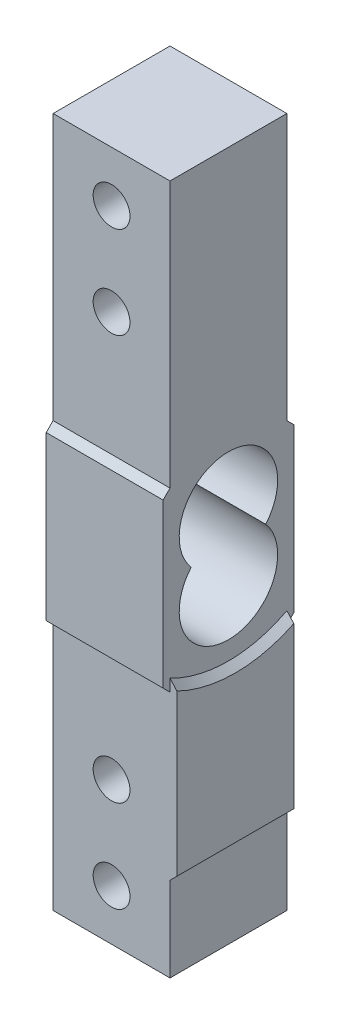
from build123d import *

# Parameters (mm, degrees)
SKETCH1_W               = 12.7
SKETCH1_H               = 12.7
BOSS_EXTRUDE1_DEPTH     = 37.5
CUT_EXTRUDE1_DEPTH      = 39.560277489
CUT_EXTRUDE1_DEPTH_BACK = 39.560277489
BOSS_EXTRUDE2_START     = -6.35
SKETCH3_W               = 0.75
SKETCH3_H               = 21.7
BOSS_EXTRUDE2_DEPTH     = 12.7
BOSS_EXTRUDE3_DEPTH     = 0.75
CHAMFER1_SIZE           = 2
CUT_EXTRUDE2_DEPTH      = 39.820999472
CUT_EXTRUDE2_DEPTH_BACK = 39.820999472
SKETCH5_R               = 2


with BuildPart() as part:
    # Sketch1 → Boss-Extrude1 (new, symmetric)
    with BuildSketch(Plane(origin=(0, 0, 0), x_dir=(1, 0, 0), z_dir=(0, 1, 0))):
        Rectangle(SKETCH1_W, SKETCH1_H)
    extrude(amount=BOSS_EXTRUDE1_DEPTH, both=True)

    # Sketch2 → Cut-Extrude1 (cut, two sides: drawn at the far end of the back side and taken through both)
    with BuildSketch(Plane(origin=(0, 0, 0), x_dir=(0, 0, -1), z_dir=(1, 0, 0)).offset(-CUT_EXTRUDE1_DEPTH_BACK)):
        with BuildLine():
            ThreePointArc((4.046294601, 0), (0, 8.85), (-4.046294601, 0))
            ThreePointArc((-4.046294601, 0), (0, -8.85), (4.046294601, 0))
        make_face()
    extrude(amount=CUT_EXTRUDE1_DEPTH + CUT_EXTRUDE1_DEPTH_BACK, mode=Mode.SUBTRACT)

    # Sketch3 → Boss-Extrude2 (add)
    with BuildSketch(Plane(origin=(0, 0, 0), x_dir=(0, 0, -1), z_dir=(1, 0, 0)).offset(BOSS_EXTRUDE2_START)):
        with Locations((6.725, -1)):
            Rectangle(SKETCH3_W, SKETCH3_H)
        with Locations((-6.725, -1)):
            Rectangle(SKETCH3_W, SKETCH3_H)
    extrude(amount=BOSS_EXTRUDE2_DEPTH)

    # Sketch4 → Boss-Extrude3 (add)
    with BuildSketch(Plane(origin=(6.35, 0, 0), x_dir=(0, 0, -1), z_dir=(1, 0, 0))):
        with BuildLine():
            Line((-6.35, -7.85), (-6.35, -29.55))
            Line((-6.35, -29.55), (6.35, -29.55))
            Line((6.35, -29.55), (6.35, -7.85))
            ThreePointArc((6.35, -7.85), (0, -9.6), (-6.35, -7.85))
        make_face()
    extrude(amount=BOSS_EXTRUDE3_DEPTH)

    # Chamfer1
    # the kernel refuses this chamfer: 2 mm, written as the material it takes off along each edge
    with BuildSketch(Plane(origin=(7.1, -29.55, 11.493365976), x_dir=(-0.9996219169112968, -0.027495876610585623, 0), z_dir=(0, 0, -1))) as chamfer1_piece_1_section:
        Polygon((CHAMFER1_SIZE * 0.999621916911, CHAMFER1_SIZE * 0.0274958766106), (-CHAMFER1_SIZE * 0.0274958766106, CHAMFER1_SIZE * 0.999621916911), (0, 0), align=None)
    chamfer1_piece_1 = extrude(amount=22.986731952, mode=Mode.PRIVATE)
    chamfer1_piece_1 = split(chamfer1_piece_1, bisect_by=Plane(origin=(6.35, -28.711332072, 0), z_dir=(1, 0, 0)), keep=Keep.TOP, mode=Mode.PRIVATE)
    add(chamfer1_piece_1, mode=Mode.SUBTRACT)
    with BuildSketch(Plane(origin=(7.1, 2.795714286, 0), x_dir=(0, -0.5793710900712427, -0.8150638870601863), z_dir=(0, 0.8150638870601863, -0.5793710900712427))) as chamfer1_piece_2_section:
        Polygon((12.395714286, CHAMFER1_SIZE), (12.395714286 + CHAMFER1_SIZE, 0), (12.395714286, 0), align=None)
    chamfer1_piece_2 = revolve(axis=Axis((7.1, 2.795714286, 0), (-1, 0, 0)), revolution_arc=109.187358772, mode=Mode.PRIVATE)
    chamfer1_piece_2 = split(chamfer1_piece_2, bisect_by=Plane(origin=(6.35, -11.230390822, 0), z_dir=(1, 0, 0)), keep=Keep.TOP, mode=Mode.PRIVATE)
    add(chamfer1_piece_2, mode=Mode.SUBTRACT)
    with BuildSketch(Plane(origin=(-11.493365976, -11.85, -7.1), x_dir=(0, 0.9996219169112968, -0.027495876610586487), z_dir=(1, 0, 0))) as chamfer1_piece_3_section:
        Polygon((CHAMFER1_SIZE * 0.999621916911, CHAMFER1_SIZE * 0.0274958766106), (-CHAMFER1_SIZE * 0.0274958766106, CHAMFER1_SIZE * 0.999621916911), (0, 0), align=None)
    chamfer1_piece_3 = extrude(amount=22.986731952, mode=Mode.PRIVATE)
    chamfer1_piece_3 = split(chamfer1_piece_3, bisect_by=Plane(origin=(0, -11.011332072, -6.35), z_dir=(0, 0, -1)), keep=Keep.TOP, mode=Mode.PRIVATE)
    add(chamfer1_piece_3, mode=Mode.SUBTRACT)
    with BuildSketch(Plane(origin=(-11.493365976, 9.85, -7.1), x_dir=(0, 0.027495876610586487, 0.9996219169112968), z_dir=(1, 0, 0))) as chamfer1_piece_4_section:
        Polygon((CHAMFER1_SIZE * 0.999621916911, CHAMFER1_SIZE * 0.0274958766106), (-CHAMFER1_SIZE * 0.0274958766106, CHAMFER1_SIZE * 0.999621916911), (0, 0), align=None)
    chamfer1_piece_4 = extrude(amount=22.986731952, mode=Mode.PRIVATE)
    chamfer1_piece_4 = split(chamfer1_piece_4, bisect_by=Plane(origin=(0, 9.011332072, -6.35), z_dir=(0, 0, -1)), keep=Keep.TOP, mode=Mode.PRIVATE)
    add(chamfer1_piece_4, mode=Mode.SUBTRACT)
    with BuildSketch(Plane(origin=(-11.493365976, 9.85, 7.1), x_dir=(0, -0.9996219169112968, 0.027495876610586497), z_dir=(1, 0, 0))) as chamfer1_piece_5_section:
        Polygon((CHAMFER1_SIZE * 0.999621916911, CHAMFER1_SIZE * 0.0274958766106), (-CHAMFER1_SIZE * 0.0274958766106, CHAMFER1_SIZE * 0.999621916911), (0, 0), align=None)
    chamfer1_piece_5 = extrude(amount=22.986731952, mode=Mode.PRIVATE)
    chamfer1_piece_5 = split(chamfer1_piece_5, bisect_by=Plane(origin=(0, 9.011332072, 6.35), z_dir=(0, 0, 1)), keep=Keep.TOP, mode=Mode.PRIVATE)
    add(chamfer1_piece_5, mode=Mode.SUBTRACT)
    with BuildSketch(Plane(origin=(-11.493365976, -11.85, 7.1), x_dir=(0, -0.027495876610586487, -0.9996219169112968), z_dir=(1, 0, 0))) as chamfer1_piece_6_section:
        Polygon((CHAMFER1_SIZE * 0.999621916911, CHAMFER1_SIZE * 0.0274958766106), (-CHAMFER1_SIZE * 0.0274958766106, CHAMFER1_SIZE * 0.999621916911), (0, 0), align=None)
    chamfer1_piece_6 = extrude(amount=22.986731952, mode=Mode.PRIVATE)
    chamfer1_piece_6 = split(chamfer1_piece_6, bisect_by=Plane(origin=(0, -11.011332072, 6.35), z_dir=(0, 0, 1)), keep=Keep.TOP, mode=Mode.PRIVATE)
    add(chamfer1_piece_6, mode=Mode.SUBTRACT)

    # Sketch5 → Cut-Extrude2 (cut, two sides: drawn at the far end of the back side and taken through both)
    with BuildSketch(Plane.XY.offset(-CUT_EXTRUDE2_DEPTH_BACK)):
        with Locations((0, 32)):
            Circle(SKETCH5_R)
        with Locations((0, 22)):
            Circle(SKETCH5_R)
        with Locations((0, -32)):
            Circle(SKETCH5_R)
        with Locations((0, -22)):
            Circle(SKETCH5_R)
    extrude(amount=CUT_EXTRUDE2_DEPTH + CUT_EXTRUDE2_DEPTH_BACK, mode=Mode.SUBTRACT)


solid = part.part
